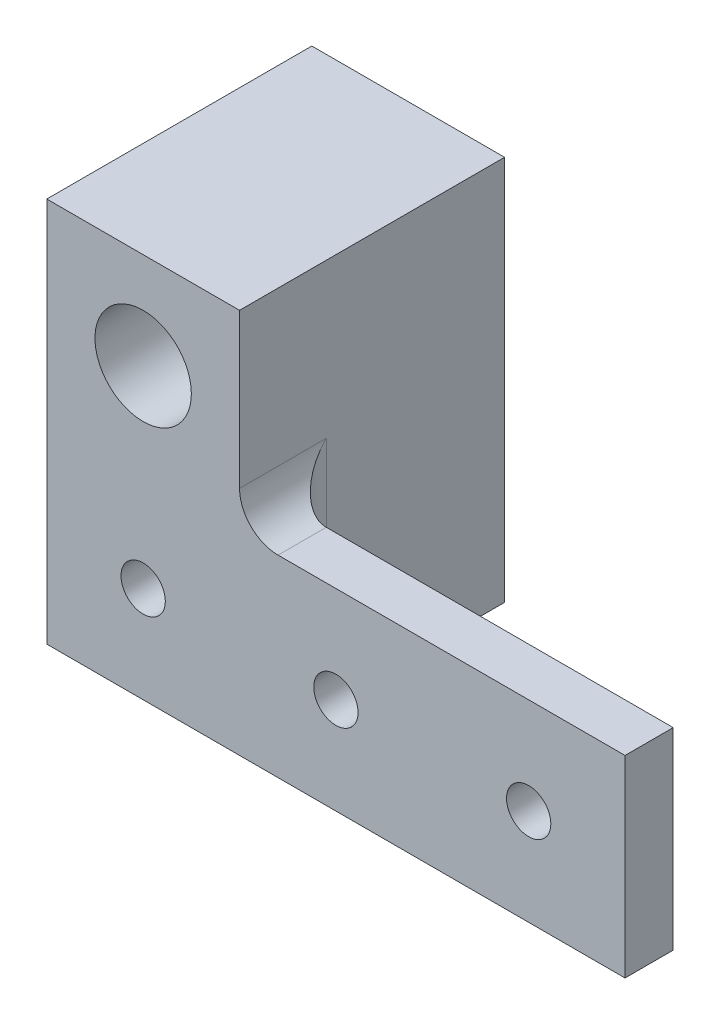
from build123d import *

# Parameters (mm, degrees)
BOSS_EXTRUDE1_DEPTH = 34.925
SKETCH2_R           = 2.921
CUT_EXTRUDE1_DEPTH  = 99.014466407
SKETCH4_W           = 50.8
SKETCH4_H           = 28.575
CUT_EXTRUDE3_DEPTH  = 99.014466407
FILLET1_R           = 5.08
SKETCH5_R           = 6.35
CUT_EXTRUDE4_DEPTH  = 22.225


with BuildPart() as part:
    # Sketch1 → Boss-Extrude1 (new body)
    with BuildSketch(Plane.XY):
        Polygon((0, 0), (0, 50.8), (25.4, 50.8), (25.4, 25.4), (76.2, 25.4), (76.2, 0), align=None)
    extrude(amount=BOSS_EXTRUDE1_DEPTH)

    # Sketch2 → Cut-Extrude1 (cut, through all)
    with BuildSketch(Plane.XY.offset(34.925)):
        with Locations((12.7, 38.1)):
            Circle(SKETCH2_R)
        with Locations((12.7, 12.7)):
            Circle(SKETCH2_R)
        with Locations((38.1, 12.7)):
            Circle(SKETCH2_R)
        with Locations((63.5, 12.7)):
            Circle(SKETCH2_R)
    extrude(amount=-CUT_EXTRUDE1_DEPTH, mode=Mode.SUBTRACT)

    # Sketch4 → Cut-Extrude3 (cut, through all)
    with BuildSketch(Plane.XZ):
        with Locations((50.8, 14.2875)):
            Rectangle(SKETCH4_W, SKETCH4_H)
    extrude(amount=-CUT_EXTRUDE3_DEPTH, mode=Mode.SUBTRACT)

    # Fillet1
    fillet1_edges = [part.edges().sort_by_distance(p)[0] for p in [
        (25.4, 12.7, 28.575),
        (25.4, 25.4, 31.75),
    ]]
    fillet(fillet1_edges, radius=FILLET1_R)

    # Sketch5 → Cut-Extrude4 (cut)
    with BuildSketch(Plane.XY.offset(34.925)):
        with Locations((12.7, 38.1)):
            Circle(SKETCH5_R)
    extrude(amount=-CUT_EXTRUDE4_DEPTH, mode=Mode.SUBTRACT)


solid = part.part
